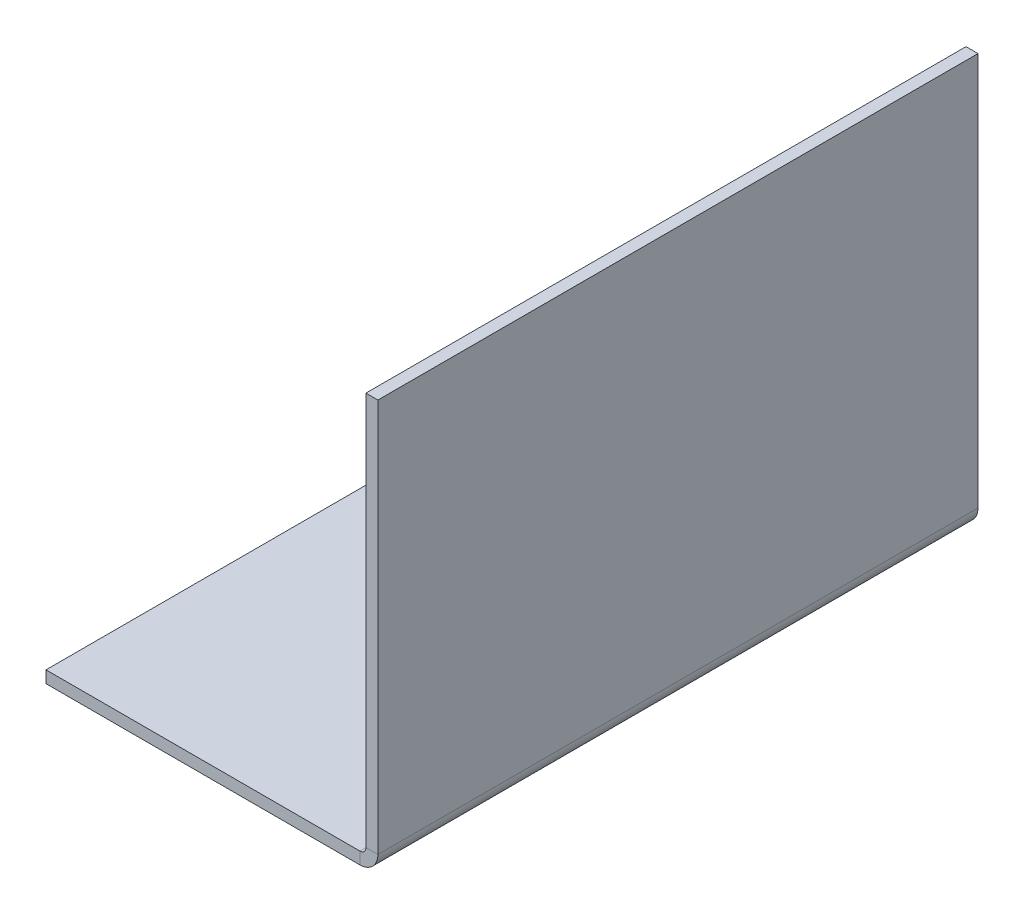
from build123d import *

# Parameters (mm, degrees)
SHEET_EXTRUDE_1_1_DEPTH = 100
THICKEN_1_T2            = 2
SHEET_METAL_1_DEPTH     = 100
SHEET_METAL_1_2_DEPTH   = 100


# Read off the part's stored shape, not the designer's step: Преобразовать-Твердое тело1
with BuildPart() as body_1:
    # Sheet Extrude 1: a surface, the sketch's curves swept straight by 100 mm
    with BuildLine(Plane.XY, mode=Mode.PRIVATE) as sheet_extrude_1_1_path:
        Line((-53.303838415, 0), (0, 0))
        Line((0, 0), (0, 66.585525728))
    sheet_extrude_1_1 = Shell.extrude(sheet_extrude_1_1_path.wire(), (0 * SHEET_EXTRUDE_1_1_DEPTH, 0 * SHEET_EXTRUDE_1_1_DEPTH, 1 * SHEET_EXTRUDE_1_1_DEPTH))
    add(Solid.thicken(sheet_extrude_1_1, -THICKEN_1_T2))

    # Sheet Metal 1 outline → Sheet Metal 1 (cut)
    with BuildSketch(Plane.XY):
        with BuildLine():
            Line((2, -2), (2, 1))
            ThreePointArc((2, 1), (1.121320344, -1.121320344), (-1, -2))
            Line((-1, -2), (2, -2))
        make_face()
    extrude(amount=SHEET_METAL_1_DEPTH, mode=Mode.SUBTRACT)

    # Sheet Metal 1 2 outline → Sheet Metal 1 2 (add)
    with BuildSketch(Plane.XY):
        with BuildLine():
            Line((0, 0), (0, 1))
            ThreePointArc((0, 1), (-0.292893219, 0.292893219), (-1, 0))
            Line((-1, 0), (0, 0))
        make_face()
    extrude(amount=SHEET_METAL_1_2_DEPTH)


solid = body_1.part
